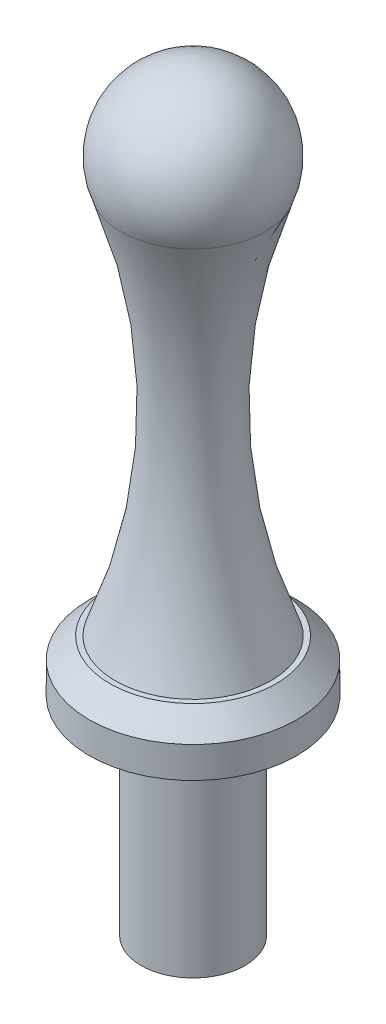
from build123d import *

# Parameters (mm, degrees)
CHAMFER1_SIZE = 1.27


with BuildPart() as part:
    # Sketch1 → Revolve1 (revolve)
    with BuildSketch(Plane.XY):
        with BuildLine():
            Line((-3.175, 6.35), (-3.175, -6.35))
            Line((-3.175, -6.35), (0, -6.35))
            Line((0, -6.35), (0, 39.6875))
            ThreePointArc((0, 39.6875), (-3.959874029, 37.570903235), (-4.399976274, 33.102470153))
            ThreePointArc((-4.399976274, 33.102470153), (-2.411195624, 21.280368821), (-4.7625, 9.525))
            Line((-4.7625, 9.525), (-6.35, 9.525))
            Line((-6.35, 9.525), (-6.35, 6.35))
            Line((-6.35, 6.35), (-3.175, 6.35))
        make_face()
    revolve(axis=Axis((0, 45.924305238, 0), (0, 1, 0)))

    # Chamfer1
    chamfer1_edges = [part.edges().sort_by_distance(p)[0] for p in [
        (6.35, 9.525, 0),
    ]]
    chamfer(chamfer1_edges, length=CHAMFER1_SIZE)


solid = part.part
